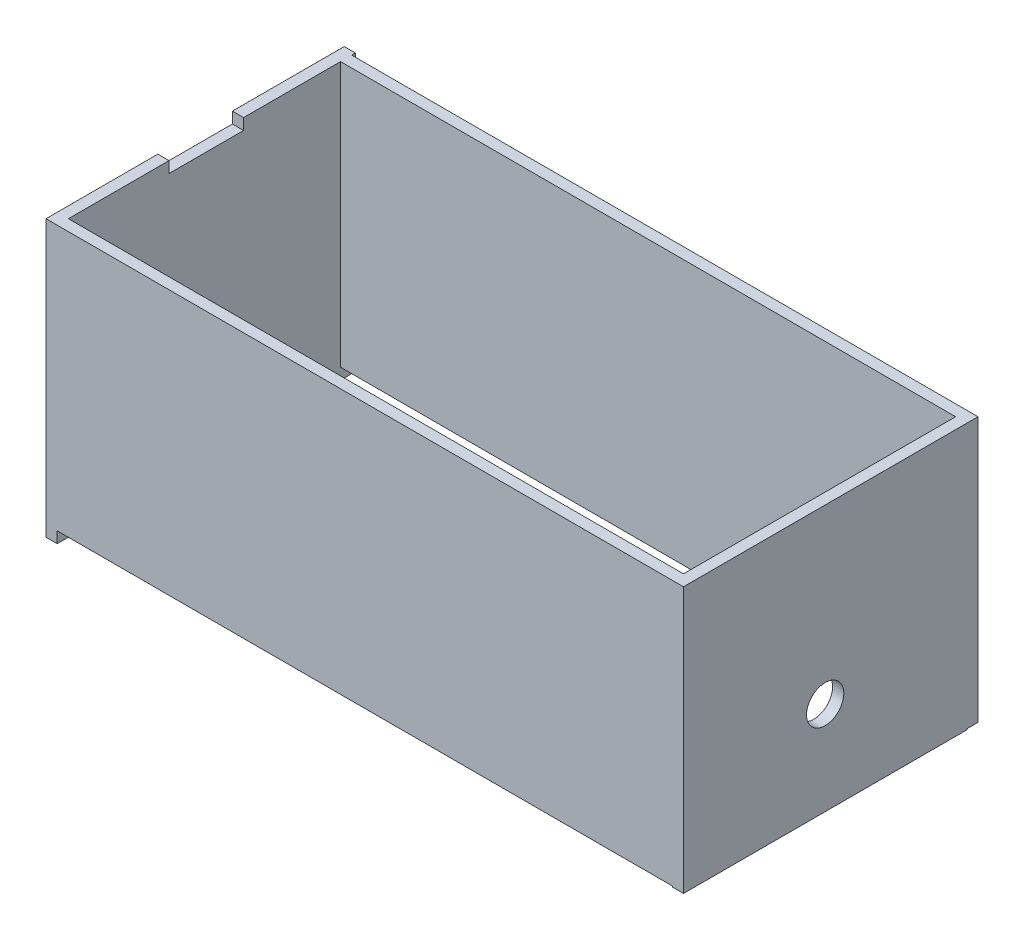
from build123d import *

# Parameters (mm, degrees)
ESBO_O1_W      = 171
ESBO_O1_H      = 71
LATERAL1_DEPTH = 3
ESBO_O2_R      = 5
FUNDO_DEPTH    = 3
ESBO_O3_W      = 76
ESBO_O3_H      = 71.248906869
ESBO_O3_R      = 5
FRENTE_DEPTH   = 3
ESBO_O4_W      = 171
ESBO_O4_H      = 71
LETARAL2_DEPTH = 3


with BuildPart() as part:
    # Esboço1 → Lateral1 (new body)
    with BuildSketch(Plane.XY):
        with Locations((13.726415094, 15.652928375)):
            Rectangle(ESBO_O1_W, ESBO_O1_H)
    extrude(amount=LATERAL1_DEPTH)

    # Esboço2 → Fundo (add)
    with BuildSketch(Plane.ZY.offset(71.773584906)):
        Polygon((0, -19.847071625), (0, 51.152928375), (-27, 51.152928375), (-27, 48.152928375), (-47, 48.152928375), (-47, 51.152928375), (-77, 51.152928375), (-77, -22.847071625), (3, -22.847071625), (3, -19.847071625), align=None)
        with Locations((-39, 2.152928375)):
            Circle(ESBO_O2_R, mode=Mode.SUBTRACT)
    extrude(amount=-FUNDO_DEPTH)

    # Esboço3 → Frente (add)
    with BuildSketch(Plane(origin=(99.226415094, 0, 0), x_dir=(0, 0, -1), z_dir=(1, 0, 0))):
        with Locations((35, 15.528474941)):
            Rectangle(ESBO_O3_W, ESBO_O3_H)
        with Locations((35, 4.904021506)):
            Circle(ESBO_O3_R, mode=Mode.SUBTRACT)
    extrude(amount=-FRENTE_DEPTH)

    # Esboço4 → Letaral2 (add)
    with BuildSketch(Plane(origin=(0, 0, -73), x_dir=(-1, 0, 0), z_dir=(0, 0, -1))):
        with Locations((-13.726415094, 15.652928375)):
            Rectangle(ESBO_O4_W, ESBO_O4_H)
    extrude(amount=LETARAL2_DEPTH)


solid = part.part
